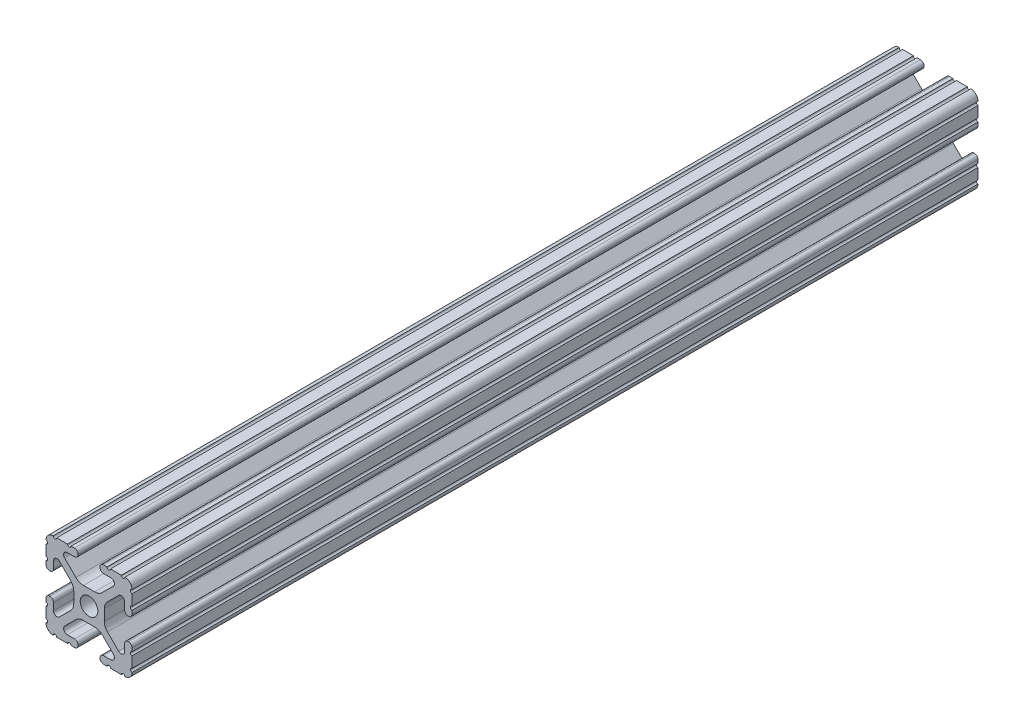
from build123d import *

# Parameters (mm, degrees)
SKETCH1_R               = 2.6035
BOSS_EXTRUDE1_DEPTH     = 304.8
CUT_EXTRUDE1_DEPTH      = 7.112
CUT_EXTRUDE1_DEPTH_BACK = 30.734
SKETCH2_W               = 362.658607085
SKETCH2_H               = 27.642551573


with BuildPart() as part:
    # Sketch1 → Boss-Extrude1 (new, symmetric)
    with BuildSketch(Plane.XY):
        with BuildLine():
            Line((-7.179650497, -8.645192506), (-3.952270251, -5.423690499))
            ThreePointArc((-3.952270251, -5.423690499), (-2.922936451, -4.736929036), (-1.709253557, -4.4958))
            Line((-1.709253557, -4.4958), (1.709253557, -4.4958))
            ThreePointArc((1.709253557, -4.4958), (2.922936451, -4.736929036), (3.952270251, -5.423690499))
            Line((3.952270251, -5.423690499), (7.179650497, -8.645192506))
            ThreePointArc((7.179650497, -8.645192506), (7.41473083, -9.822813117), (6.416408329, -10.4902))
            Line((6.416408329, -10.4902), (4.287512407, -10.4902))
            ThreePointArc((4.287512407, -10.4902), (3.54574862, -10.79744862), (3.2385, -11.539212407))
            Line((3.2385, -11.539212407), (3.2385, -11.650987593))
            ThreePointArc((3.2385, -11.650987593), (3.54574862, -12.39275138), (4.287512407, -12.7))
            Line((4.287512407, -12.7), (5.317126718, -12.7))
            ThreePointArc((5.317126718, -12.7), (5.825126718, -12.192), (6.333126718, -12.7))
            Line((6.333126718, -12.7), (9.550443118, -12.7))
            ThreePointArc((9.550443118, -12.7), (10.058366869, -12.192000006), (10.566443095, -12.699847501))
            ThreePointArc((10.566443095, -12.699847501), (12.082537762, -12.08250727), (12.699846982, -10.566399977))
            ThreePointArc((12.699846982, -10.566399977), (12.192000006, -10.058323491), (12.7, -9.5504))
            Line((12.7, -9.5504), (12.7, -6.3330836))
            ThreePointArc((12.7, -6.3330836), (12.192, -5.8250836), (12.7, -5.3170836))
            Line((12.7, -5.3170836), (12.7, -4.287469289))
            ThreePointArc((12.7, -4.287469289), (12.39275138, -3.545705502), (11.650987593, -3.238456882))
            Line((11.650987593, -3.238456882), (11.539212407, -3.238456882))
            ThreePointArc((11.539212407, -3.238456882), (10.79744862, -3.545705502), (10.4902, -4.287469289))
            Line((10.4902, -4.287469289), (10.4902, -6.402089023))
            ThreePointArc((10.4902, -6.402089023), (9.856505071, -7.351067942), (8.737131347, -7.129408934))
            Line((8.737131347, -7.129408934), (5.441005833, -3.840816462))
            ThreePointArc((5.441005833, -3.840816462), (4.750877967, -2.809883091), (4.5085, -1.593185507))
            Line((4.5085, -1.593185507), (4.5085, 1.593185507))
            ThreePointArc((4.5085, 1.593185507), (4.750877967, 2.809883091), (5.441005833, 3.840816462))
            Line((5.441005833, 3.840816462), (8.737131347, 7.129408934))
            ThreePointArc((8.737131347, 7.129408934), (9.856505071, 7.351067942), (10.4902, 6.402089023))
            Line((10.4902, 6.402089023), (10.4902, 4.287469289))
            ThreePointArc((10.4902, 4.287469289), (10.79744862, 3.545705502), (11.539212407, 3.238456882))
            Line((11.539212407, 3.238456882), (11.650987593, 3.238456882))
            ThreePointArc((11.650987593, 3.238456882), (12.39275138, 3.545705502), (12.7, 4.287469289))
            Line((12.7, 4.287469289), (12.7, 5.3170836))
            ThreePointArc((12.7, 5.3170836), (12.192, 5.8250836), (12.7, 6.3330836))
            Line((12.7, 6.3330836), (12.7, 9.5504))
            ThreePointArc((12.7, 9.5504), (12.192000006, 10.058323491), (12.699846982, 10.566399977))
            ThreePointArc((12.699846982, 10.566399977), (12.082537762, 12.08250727), (10.566443095, 12.699847501))
            ThreePointArc((10.566443095, 12.699847501), (10.058366869, 12.192000006), (9.550443118, 12.7))
            Line((9.550443118, 12.7), (6.333126718, 12.7))
            ThreePointArc((6.333126718, 12.7), (5.825126718, 12.192), (5.317126718, 12.7))
            Line((5.317126718, 12.7), (4.287512407, 12.7))
            ThreePointArc((4.287512407, 12.7), (3.54574862, 12.39275138), (3.2385, 11.650987593))
            Line((3.2385, 11.650987593), (3.2385, 11.539212407))
            ThreePointArc((3.2385, 11.539212407), (3.54574862, 10.79744862), (4.287512407, 10.4902))
            Line((4.287512407, 10.4902), (6.476788598, 10.4902))
            ThreePointArc((6.476788598, 10.4902), (7.432222385, 9.85140422), (7.207036008, 8.724370562))
            Line((7.207036008, 8.724370562), (3.898272566, 5.423169045))
            ThreePointArc((3.898272566, 5.423169045), (2.869120213, 4.736787962), (1.655778399, 4.4958))
            Line((1.655778399, 4.4958), (-1.655778399, 4.4958))
            ThreePointArc((-1.655778399, 4.4958), (-2.869120213, 4.736787962), (-3.898272566, 5.423169045))
            Line((-3.898272566, 5.423169045), (-7.207036008, 8.724370562))
            ThreePointArc((-7.207036008, 8.724370562), (-7.432222385, 9.85140422), (-6.476788598, 10.4902))
            Line((-6.476788598, 10.4902), (-4.287512407, 10.4902))
            ThreePointArc((-4.287512407, 10.4902), (-3.54574862, 10.79744862), (-3.2385, 11.539212407))
            Line((-3.2385, 11.539212407), (-3.2385, 11.650987593))
            ThreePointArc((-3.2385, 11.650987593), (-3.54574862, 12.39275138), (-4.287512407, 12.7))
            Line((-4.287512407, 12.7), (-5.317126718, 12.7))
            ThreePointArc((-5.317126718, 12.7), (-5.825126718, 12.192), (-6.333126718, 12.7))
            Line((-6.333126718, 12.7), (-9.550443118, 12.7))
            ThreePointArc((-9.550443118, 12.7), (-10.058366869, 12.192000006), (-10.566443095, 12.699847501))
            ThreePointArc((-10.566443095, 12.699847501), (-12.082537762, 12.08250727), (-12.699846982, 10.566399977))
            ThreePointArc((-12.699846982, 10.566399977), (-12.192000006, 10.058323491), (-12.7, 9.5504))
            Line((-12.7, 9.5504), (-12.7, 6.3330836))
            ThreePointArc((-12.7, 6.3330836), (-12.192, 5.8250836), (-12.7, 5.3170836))
            Line((-12.7, 5.3170836), (-12.7, 4.287469289))
            ThreePointArc((-12.7, 4.287469289), (-12.39275138, 3.545705502), (-11.650987593, 3.238456882))
            Line((-11.650987593, 3.238456882), (-11.539212407, 3.238456882))
            ThreePointArc((-11.539212407, 3.238456882), (-10.79744862, 3.545705502), (-10.4902, 4.287469289))
            Line((-10.4902, 4.287469289), (-10.4902, 6.402089023))
            ThreePointArc((-10.4902, 6.402089023), (-9.856505071, 7.351067942), (-8.737131347, 7.129408934))
            Line((-8.737131347, 7.129408934), (-5.441005833, 3.840816462))
            ThreePointArc((-5.441005833, 3.840816462), (-4.750877967, 2.809883091), (-4.5085, 1.593185507))
            Line((-4.5085, 1.593185507), (-4.5085, -1.593185507))
            ThreePointArc((-4.5085, -1.593185507), (-4.750877967, -2.809883091), (-5.441005833, -3.840816462))
            Line((-5.441005833, -3.840816462), (-8.737131347, -7.129408934))
            ThreePointArc((-8.737131347, -7.129408934), (-9.856505071, -7.351067942), (-10.4902, -6.402089023))
            Line((-10.4902, -6.402089023), (-10.4902, -4.287469289))
            ThreePointArc((-10.4902, -4.287469289), (-10.79744862, -3.545705502), (-11.539212407, -3.238456882))
            Line((-11.539212407, -3.238456882), (-11.650987593, -3.238456882))
            ThreePointArc((-11.650987593, -3.238456882), (-12.39275138, -3.545705502), (-12.7, -4.287469289))
            Line((-12.7, -4.287469289), (-12.7, -5.3170836))
            ThreePointArc((-12.7, -5.3170836), (-12.192, -5.8250836), (-12.7, -6.3330836))
            Line((-12.7, -6.3330836), (-12.7, -9.5504))
            ThreePointArc((-12.7, -9.5504), (-12.192000006, -10.058323491), (-12.699846982, -10.566399977))
            ThreePointArc((-12.699846982, -10.566399977), (-12.082537762, -12.08250727), (-10.566443095, -12.699847501))
            ThreePointArc((-10.566443095, -12.699847501), (-10.058366869, -12.192000006), (-9.550443118, -12.7))
            Line((-9.550443118, -12.7), (-6.333126718, -12.7))
            ThreePointArc((-6.333126718, -12.7), (-5.825126718, -12.192), (-5.317126718, -12.7))
            Line((-5.317126718, -12.7), (-4.287512407, -12.7))
            ThreePointArc((-4.287512407, -12.7), (-3.54574862, -12.39275138), (-3.2385, -11.650987593))
            Line((-3.2385, -11.650987593), (-3.2385, -11.539212407))
            ThreePointArc((-3.2385, -11.539212407), (-3.54574862, -10.79744862), (-4.287512407, -10.4902))
            Line((-4.287512407, -10.4902), (-6.416408329, -10.4902))
            ThreePointArc((-6.416408329, -10.4902), (-7.41473083, -9.822813117), (-7.179650497, -8.645192506))
        make_face()
        Circle(SKETCH1_R, mode=Mode.SUBTRACT)
    extrude(amount=BOSS_EXTRUDE1_DEPTH, both=True)

    # Sketch2 → Cut-Extrude1 (cut, two sides: drawn at the far end of the back side and taken through both)
    with BuildSketch(Plane(origin=(12.7, 0, 0), x_dir=(0, 0, -1), z_dir=(1, 0, 0)).offset(-CUT_EXTRUDE1_DEPTH_BACK)):
        with Locations((126.205743533, -0.275832689)):
            Rectangle(SKETCH2_W, SKETCH2_H)
    extrude(amount=CUT_EXTRUDE1_DEPTH + CUT_EXTRUDE1_DEPTH_BACK, mode=Mode.SUBTRACT)


solid = part.part
